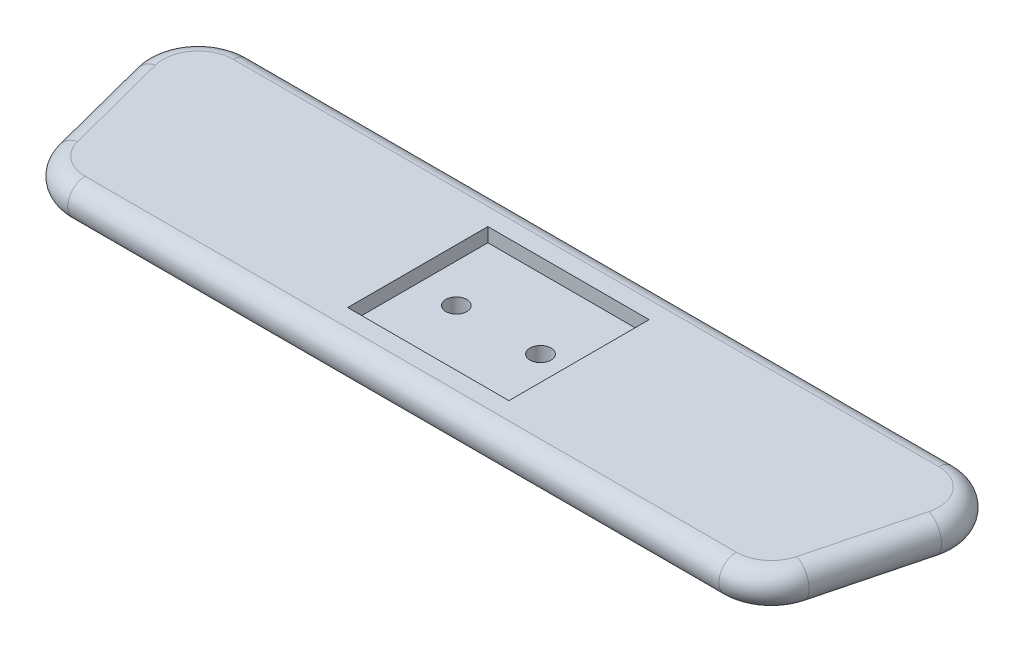
from build123d import *

# Parameters (mm, degrees)
BOSS_EXTRUDE1_DEPTH = 10
SKETCH2_W           = 46
SKETCH2_H           = 40
CUT_EXTRUDE1_DEPTH  = 4
SKETCH2_3_R         = 3
CUT_EXTRUDE2_DEPTH  = 120.873502812
FILLET1_R           = 5
SKETCH3_R           = 2
CUT_EXTRUDE3_DEPTH  = 8


with BuildPart() as part:
    # Sketch1 → Boss-Extrude1 (new body)
    with BuildSketch(Plane(origin=(0, 0, 0), x_dir=(1, 0, 0), z_dir=(0, 1, 0))):
        with BuildLine():
            Line((115.149446157, 11.244299939), (107.390918627, -18.755700061))
            ThreePointArc((107.390918627, -18.755700061), (102.051963222, -26.860343606), (92.868704021, -30))
            Line((92.868704021, -30), (-92.868704021, -30))
            ThreePointArc((-92.868704021, -30), (-102.051963222, -26.860343606), (-107.390918627, -18.755700061))
            Line((-107.390918627, -18.755700061), (-115.149446157, 11.244299939))
            ThreePointArc((-115.149446157, 11.244299939), (-112.487575158, 24.183259201), (-100.627231552, 30))
            Line((-100.627231552, 30), (100.627231552, 30))
            ThreePointArc((100.627231552, 30), (112.487575158, 24.183259201), (115.149446157, 11.244299939))
        make_face()
    extrude(amount=BOSS_EXTRUDE1_DEPTH)

    # Sketch2 → Cut-Extrude1 (cut)
    with BuildSketch(Plane(origin=(0, 10, 0), x_dir=(1, 0, 0), z_dir=(0, 1, 0))):
        Rectangle(SKETCH2_W, SKETCH2_H)
    extrude(amount=-CUT_EXTRUDE1_DEPTH, mode=Mode.SUBTRACT)

    # Sketch2<3> → Cut-Extrude2 (cut, through all)
    with BuildSketch(Plane(origin=(0, 10, 0), x_dir=(1, 0, 0), z_dir=(0, 1, 0))):
        with Locations(Location((-12, 0, 0), (0, 0, 270))):
            Circle(SKETCH2_3_R)
        with Locations(Location((12, 0, 0), (0, 0, 270))):
            Circle(SKETCH2_3_R)
    extrude(amount=-CUT_EXTRUDE2_DEPTH, mode=Mode.SUBTRACT)

    # Fillet1
    fillet1_edges = [part.edges().sort_by_distance(p)[0] for p in [
        (0, 0, 30),
        (-102.051963222, 0, 26.860343606),
        (-111.270182392, 0, 3.755700061),
        (-112.487575158, 0, -24.183259201),
        (0, 10, 30),
        (102.051963222, 10, 26.860343606),
        (111.270182392, 10, 3.755700061),
        (112.487575158, 10, -24.183259201),
        (0, 10, -30),
        (0, 0, -30),
        (-111.270182392, 10, 3.755700061),
        (111.270182392, 0, 3.755700061),
    ]]
    fillet(fillet1_edges, radius=FILLET1_R - 0.0001)  # a hair under: the kernel refuses the full size

    # Sketch3 → Cut-Extrude3 (cut)
    with BuildSketch(Plane.XZ):
        with Locations(Location((-70, 8, 0), (0, 0, 270))):
            Circle(SKETCH3_R)
        with Locations(Location((-70, -8, 0), (0, 0, 90))):
            Circle(SKETCH3_R)
        with Locations(Location((70, -8, 0), (0, 0, 270))):
            Circle(SKETCH3_R)
        with Locations(Location((70, 8, 0), (0, 0, 90))):
            Circle(SKETCH3_R)
    extrude(amount=-CUT_EXTRUDE3_DEPTH, mode=Mode.SUBTRACT)


solid = part.part
